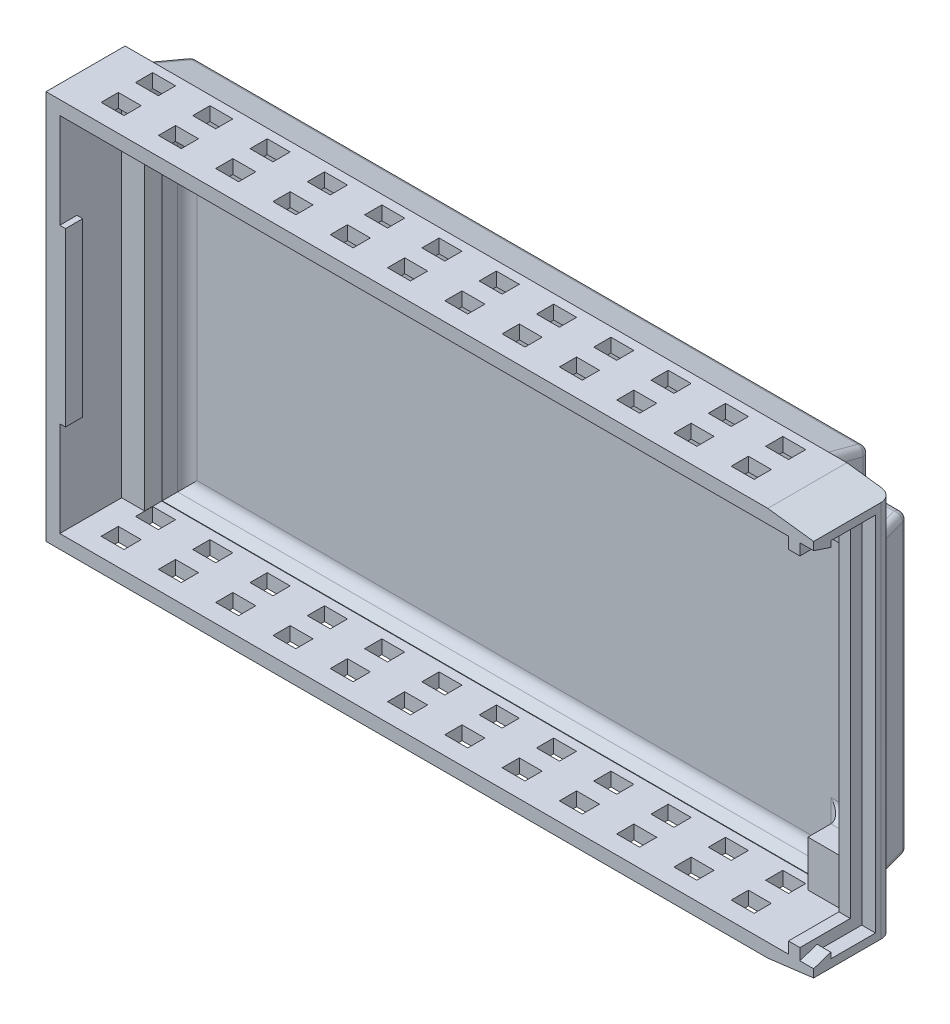
from build123d import *
from OCP.BRepFilletAPI import BRepFilletAPI_MakeChamfer

# Parameters (mm, degrees)
SKETCH1_W           = 67
SKETCH1_H           = 34
BOSS_EXTRUDE1_DEPTH = 1.5
EXTRUDE_THIN1_START = 1.5
SKETCH1_2_W         = 67
SKETCH1_2_H         = 34
SKETCH1_2_W_2       = 64.6
SKETCH1_2_H_2       = 31.6
EXTRUDE_THIN1_DEPTH = 5.4
SKETCH2_W           = 5.4
SKETCH2_H           = 31.6
CUT_EXTRUDE1_DEPTH  = 69.309955351
EXTRUDE_THIN2_DEPTH = 1
SKETCH4_W           = 61.6
SKETCH4_H           = 31.6
CUT_EXTRUDE2_DEPTH  = 38.952733762
SKETCH5_W           = 64
SKETCH5_H           = 34
BOSS_EXTRUDE2_DEPTH = 3
BOSS_EXTRUDE2_TAPER = 15
SKETCH6_W           = 5
SKETCH6_H           = 4
CUT_EXTRUDE3_DEPTH  = 3
SHELL1_T            = -1.2
SKETCH7_W           = 4
SKETCH7_H           = 4
BOSS_EXTRUDE3_DEPTH = 1.2
FILLET1_R           = 0.6
FILLET2_R           = 1
CHAMFER1_SIZE       = 4
CHAMFER1_SIZE2      = 0.5
FILLET4_R           = 1
SKETCH8_W           = 2
SKETCH8_H           = 1.5
CUT_EXTRUDE4_DEPTH  = 49.227170905
SKETCH10_W          = 1.2
SKETCH10_H          = 1.5
BOSS_EXTRUDE4_DEPTH = 0.5
CHAMFER2_SIZE       = 1.5
CHAMFER2_SIZE_2     = 0.5
SKETCH11_W          = 1.5
SKETCH11_H          = 15
BOSS_EXTRUDE5_DEPTH = 0.5


with BuildPart() as part:
    # Sketch1 → Boss-Extrude1 (new body)
    with BuildSketch(Plane.XY):
        Rectangle(SKETCH1_W, SKETCH1_H)
    extrude(amount=BOSS_EXTRUDE1_DEPTH)

    # Sketch1<2> → Extrude-Thin1 (add)
    with BuildSketch(Plane.XY.offset(EXTRUDE_THIN1_START)):
        Rectangle(SKETCH1_2_W, SKETCH1_2_H)
        Rectangle(SKETCH1_2_W_2, SKETCH1_2_H_2, mode=Mode.SUBTRACT)
    extrude(amount=EXTRUDE_THIN1_DEPTH)

    # Sketch2 → Cut-Extrude1 (cut, through all)
    with BuildSketch(Plane.ZY.offset(-32.3)):
        with Locations((4.2, 0)):
            Rectangle(SKETCH2_W, SKETCH2_H)
    extrude(amount=-CUT_EXTRUDE1_DEPTH, mode=Mode.SUBTRACT)

    # Sketch3 → Extrude-Thin2 (add)
    with BuildSketch(Plane.ZY.offset(-32.3)):
        Polygon((6.9, -15.8), (1.5, -15.8), (1.5, 15.8), (6.9, 15.8), (6.9, 14.8), (2.5, 14.8), (2.5, -14.8), (6.9, -14.8), align=None)
    extrude(amount=EXTRUDE_THIN2_DEPTH)

    # Sketch4 → Cut-Extrude2 (cut, through all)
    with BuildSketch(Plane.XY.offset(1.5)):
        with Locations((0.5, 0)):
            Rectangle(SKETCH4_W, SKETCH4_H)
    extrude(amount=-CUT_EXTRUDE2_DEPTH, mode=Mode.SUBTRACT)


with BuildPart() as body_2:
    # Sketch5 → Boss-Extrude2 (new body)
    with BuildSketch(Plane(origin=(0, 0, 0), x_dir=(-1, 0, 0), z_dir=(0, 0, -1))):
        with Locations((-0.5, 0)):
            Rectangle(SKETCH5_W, SKETCH5_H)
    extrude(amount=BOSS_EXTRUDE2_DEPTH, taper=BOSS_EXTRUDE2_TAPER)

    # Sketch6 → Cut-Extrude3 (cut)
    with BuildSketch(Plane(origin=(0, 0, -3), x_dir=(-1, 0, 0), z_dir=(0, 0, -1))):
        with Locations((-31, -15)):
            Rectangle(SKETCH6_W, SKETCH6_H)
        with Locations((-31, 15)):
            Rectangle(SKETCH6_W, SKETCH6_H)
    extrude(amount=-CUT_EXTRUDE3_DEPTH, mode=Mode.SUBTRACT)

    # Shell1
    shell1_openings = [body_2.faces().sort_by_distance(p)[0] for p in [
        (0.052238806, 0, 0),
    ]]
    offset(amount=SHELL1_T, openings=shell1_openings, kind=Kind.INTERSECTION)


with BuildPart() as part_1:
    add(part.part)

    # Combine1: union body 2
    add(body_2.part)

    # Sketch7 → Boss-Extrude3 (add)
    with BuildSketch(Plane.XY):
        with Locations((29.3, -13.8)):
            Rectangle(SKETCH7_W, SKETCH7_H)
        with Locations((29.3, 13.8)):
            Rectangle(SKETCH7_W, SKETCH7_H)
    extrude(amount=BOSS_EXTRUDE3_DEPTH)

    # Fillet1
    fillet1_edges = [part_1.edges().sort_by_distance(p)[0] for p in [
        (-31.098076211, -16.598076211, -1.5),
        (28.5, 16.598076211, -1.5),
        (-31.098076211, 16.598076211, -1.5),
        (32.098076211, -13, -1.5),
        (32.098076211, 13, -1.5),
        (28.5, -16.598076211, -1.5),
        (-1.098076211, -16.196152423, -3),
        (-30.696152423, 0, -3),
        (-1.098076211, 16.196152423, -3),
        (31.696152423, 0, -3),
        (28.5, -13, -1.5),
        (30.098076211, -13, -3),
        (28.5, -14.598076211, -3),
        (28.5, 13, -1.5),
        (28.5, 14.598076211, -3),
        (30.098076211, 13, -3),
    ]]
    fillet(fillet1_edges, radius=FILLET1_R)

    # Fillet2
    fillet2_edges = [part_1.edges().sort_by_distance(p)[0] for p in [
        (-29.775360037, 0, -1.8),
        (-1.237680019, 15.275360037, -1.8),
        (30.775360037, 0, -1.8),
        (-1.237680019, -15.275360037, -1.8),
        (27.3, -13.537680019, -1.8),
        (29.037680019, -11.8, -1.8),
        (29.037680019, 11.8, -1.8),
        (27.3, 13.537680019, -1.8),
    ]]
    fillet(fillet2_edges, radius=FILLET2_R)

    # Chamfer1: one chamfer whose edges measure the first distance from different faces: ONE call of the kernel's chamfer builder (chamfer() names one face for all edges)
    chamfer1_edges_1 = [part_1.edges().sort_by_distance(p)[0] for p in [
        (33.5, -17, 3.45),
    ]]
    chamfer1_side_1 = [part_1.faces().sort_by_distance(p)[0] for p in [
        (0, -17, 3.45),
    ]]
    chamfer1_edges_2 = [part_1.edges().sort_by_distance(p)[0] for p in [
        (33.5, 17, 3.45),
    ]]
    chamfer1_side_2 = [part_1.faces().sort_by_distance(p)[0] for p in [
        (0, 17, 3.45),
    ]]
    chamfer1 = BRepFilletAPI_MakeChamfer(part_1.part.solid().wrapped)
    for e in chamfer1_edges_1:
        chamfer1.Add(CHAMFER1_SIZE, CHAMFER1_SIZE2, e.wrapped, chamfer1_side_1[0].wrapped)  # the first distance lies on this face
    for e in chamfer1_edges_2:
        chamfer1.Add(CHAMFER1_SIZE, CHAMFER1_SIZE2, e.wrapped, chamfer1_side_2[0].wrapped)  # the first distance lies on this face
    add(Compound.cast(chamfer1.Shape()), mode=Mode.REPLACE)

    # Fillet4
    fillet4_edges = [part_1.edges().sort_by_distance(p)[0] for p in [
        (33.5, 0, 0),
    ]]
    fillet(fillet4_edges, radius=FILLET4_R - 0.0001)  # a hair under: the kernel refuses the full size

    # Sketch8 → Cut-Extrude4 (cut, through all)
    with BuildSketch(Plane.XZ.offset(17)):
        with Locations((-24.286254052, 4.556850819)):
            Rectangle(SKETCH8_W, SKETCH8_H)
        with Locations((-29.286254052, 4.556850819)):
            Rectangle(SKETCH8_W, SKETCH8_H)
        with Locations((-19.286254052, 4.556850819)):
            Rectangle(SKETCH8_W, SKETCH8_H)
        with Locations((-14.286254052, 4.556850819)):
            Rectangle(SKETCH8_W, SKETCH8_H)
        with Locations((-9.286254052, 4.556850819)):
            Rectangle(SKETCH8_W, SKETCH8_H)
        with Locations((-4.286254052, 4.556850819)):
            Rectangle(SKETCH8_W, SKETCH8_H)
        with Locations((0.713745948, 4.556850819)):
            Rectangle(SKETCH8_W, SKETCH8_H)
        with Locations((5.713745948, 4.556850819)):
            Rectangle(SKETCH8_W, SKETCH8_H)
        with Locations((10.713745948, 4.556850819)):
            Rectangle(SKETCH8_W, SKETCH8_H)
        with Locations((15.713745948, 4.556850819)):
            Rectangle(SKETCH8_W, SKETCH8_H)
        with Locations((20.713745948, 4.556850819)):
            Rectangle(SKETCH8_W, SKETCH8_H)
        with Locations((25.713745948, 4.556850819)):
            Rectangle(SKETCH8_W, SKETCH8_H)
        with Locations((-24.286254052, 1.556850819)):
            Rectangle(SKETCH8_W, SKETCH8_H)
        with Locations((-19.286254052, 1.556850819)):
            Rectangle(SKETCH8_W, SKETCH8_H)
        with Locations((-14.286254052, 1.556850819)):
            Rectangle(SKETCH8_W, SKETCH8_H)
        with Locations((-9.286254052, 1.556850819)):
            Rectangle(SKETCH8_W, SKETCH8_H)
        with Locations((-4.286254052, 1.556850819)):
            Rectangle(SKETCH8_W, SKETCH8_H)
        with Locations((0.713745948, 1.556850819)):
            Rectangle(SKETCH8_W, SKETCH8_H)
        with Locations((5.713745948, 1.556850819)):
            Rectangle(SKETCH8_W, SKETCH8_H)
        with Locations((10.713745948, 1.556850819)):
            Rectangle(SKETCH8_W, SKETCH8_H)
        with Locations((15.713745948, 1.556850819)):
            Rectangle(SKETCH8_W, SKETCH8_H)
        with Locations((20.713745948, 1.556850819)):
            Rectangle(SKETCH8_W, SKETCH8_H)
        with Locations((25.713745948, 1.556850819)):
            Rectangle(SKETCH8_W, SKETCH8_H)
        with Locations((-29.286254052, 1.556850819)):
            Rectangle(SKETCH8_W, SKETCH8_H)
    extrude(amount=-CUT_EXTRUDE4_DEPTH, mode=Mode.SUBTRACT)

    # Sketch10 → Boss-Extrude4 (add)
    with BuildSketch(Plane.XZ.offset(-15.8)):
        with Locations((32.9, 6.15)):
            Rectangle(SKETCH10_W, SKETCH10_H)
    boss_extrude4 = extrude(amount=BOSS_EXTRUDE4_DEPTH)

    # Mirror5: Boss-Extrude4 across plane
    add(boss_extrude4.mirror(Plane.ZX))

    # Chamfer2
    chamfer2_edges_1 = [part_1.edges().sort_by_distance(p)[0] for p in [
        (32.9, 15.3, 6.9),
    ]]
    chamfer2_side_1 = [part_1.faces().sort_by_distance(p)[0] for p in [
        (32.9, 15.3, 6.89),
    ]]
    chamfer2_edges_2 = [part_1.edges().sort_by_distance(p)[0] for p in [
        (32.9, -15.3, 6.9),
    ]]
    chamfer2_side_2 = [part_1.faces().sort_by_distance(p)[0] for p in [
        (32.9, -15.3, 6.89),
    ]]
    chamfer2 = BRepFilletAPI_MakeChamfer(part_1.part.solid().wrapped)
    for e in chamfer2_edges_1:
        chamfer2.Add(CHAMFER2_SIZE - 0.0001, CHAMFER2_SIZE_2 - 0.0001, e.wrapped, chamfer2_side_1[0].wrapped)
    for e in chamfer2_edges_2:
        chamfer2.Add(CHAMFER2_SIZE - 0.0001, CHAMFER2_SIZE_2 - 0.0001, e.wrapped, chamfer2_side_2[0].wrapped)
    add(Compound.cast(chamfer2.Shape()), mode=Mode.REPLACE)  # a hair under: the kernel refuses the full size

    # Sketch11 → Boss-Extrude5 (add)
    with BuildSketch(Plane(origin=(-32.3, 0, 0), x_dir=(0, 0, -1), z_dir=(1, 0, 0))):
        with Locations((-6.15, 0)):
            Rectangle(SKETCH11_W, SKETCH11_H)
    extrude(amount=BOSS_EXTRUDE5_DEPTH)


solid = part_1.part
